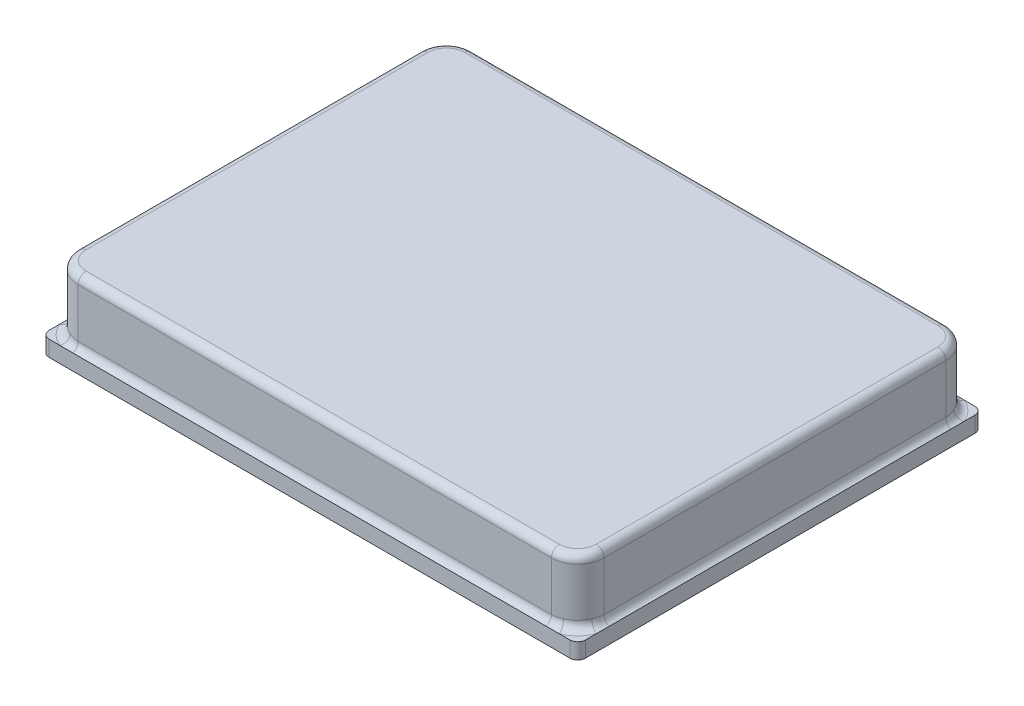
from build123d import *

# Parameters (mm, degrees)
SKETCH1_W           = 200
SKETCH1_H           = 150
SKETCH1_R           = 3
BOSS_EXTRUDE1_DEPTH = 24.5
SKETCH2_W           = 200
SKETCH2_H           = 150
BOSS_EXTRUDE2_DEPTH = 5
SKETCH3_W           = 204
SKETCH3_H           = 154
SKETCH3_W_2         = 189.5
SKETCH3_H_2         = 139.5
BOSS_EXTRUDE3_DEPTH = 5
SKETCH4_W           = 204
SKETCH4_H           = 154
SKETCH4_W_2         = 200
SKETCH4_H_2         = 150
BOSS_EXTRUDE4_DEPTH = 1
FILLET1_R           = 10
FILLET2_R           = 3


with BuildPart() as part:
    # Sketch1 → Boss-Extrude1 (new body)
    with BuildSketch(Plane(origin=(0, 0, 0), x_dir=(1, 0, 0), z_dir=(0, 1, 0))):
        with Locations((100, 75)):
            Rectangle(SKETCH1_W, SKETCH1_H)
        with BuildLine():
            Line((9.846194078, 18.9), (5.25, 18.9))
            Line((5.25, 18.9), (5.25, 131.1))
            Line((5.25, 131.1), (9.846194078, 131.1))
            ThreePointArc((9.846194078, 131.1), (16.248201641, 133.751798359), (18.9, 140.153805922))
            Line((18.9, 140.153805922), (18.9, 144.75))
            Line((18.9, 144.75), (181.1, 144.75))
            Line((181.1, 144.75), (181.1, 140.153805922))
            ThreePointArc((181.1, 140.153805922), (183.751798359, 133.751798359), (190.153805922, 131.1))
            Line((190.153805922, 131.1), (194.75, 131.1))
            Line((194.75, 131.1), (194.75, 18.9))
            Line((194.75, 18.9), (190.153805922, 18.9))
            ThreePointArc((190.153805922, 18.9), (183.751798359, 16.248201641), (181.1, 9.846194078))
            Line((181.1, 9.846194078), (181.1, 5.25))
            Line((181.1, 5.25), (18.9, 5.25))
            Line((18.9, 5.25), (18.9, 9.846194078))
            ThreePointArc((18.9, 9.846194078), (16.248201641, 16.248201641), (9.846194078, 18.9))
        make_face(mode=Mode.SUBTRACT)
        with Locations((9.846194078, 9.846194078)):
            Circle(SKETCH1_R, mode=Mode.SUBTRACT)
        with Locations((190.153805922, 9.846194078)):
            Circle(SKETCH1_R, mode=Mode.SUBTRACT)
        with Locations((190.153805922, 140.153805922)):
            Circle(SKETCH1_R, mode=Mode.SUBTRACT)
        with Locations((9.846194078, 140.153805922)):
            Circle(SKETCH1_R, mode=Mode.SUBTRACT)
    extrude(amount=BOSS_EXTRUDE1_DEPTH)

    # Sketch2 → Boss-Extrude2 (add)
    with BuildSketch(Plane(origin=(0, 24.5, 0), x_dir=(1, 0, 0), z_dir=(0, 1, 0))):
        with Locations((100, 75)):
            Rectangle(SKETCH2_W, SKETCH2_H)
    extrude(amount=BOSS_EXTRUDE2_DEPTH)

    # Sketch3 → Boss-Extrude3 (add)
    with BuildSketch(Plane.XZ):
        with Locations((100, -75)):
            Rectangle(SKETCH3_W, SKETCH3_H)
        with Locations((100, -75)):
            Rectangle(SKETCH3_W_2, SKETCH3_H_2, mode=Mode.SUBTRACT)
    extrude(amount=-BOSS_EXTRUDE3_DEPTH)

    # Sketch4 → Boss-Extrude4 (add)
    with BuildSketch(Plane.XZ):
        with Locations((100, -75)):
            Rectangle(SKETCH4_W, SKETCH4_H)
        with Locations((100, -75)):
            Rectangle(SKETCH4_W_2, SKETCH4_H_2, mode=Mode.SUBTRACT)
    extrude(amount=BOSS_EXTRUDE4_DEPTH)

    # Fillet1
    fillet1_edges = [part.edges().sort_by_distance(p)[0] for p in [
        (200, 17.25, -150),
        (200, 17.25, 0),
        (0, 17.25, -150),
        (0, 17.25, 0),
    ]]
    fillet(fillet1_edges, radius=FILLET1_R)

    # Fillet2
    fillet2_edges = [part.edges().sort_by_distance(p)[0] for p in [
        (197.071067812, 5, -2.928932188),
        (197.071067812, 5, -147.071067812),
        (2.928932188, 5, -147.071067812),
        (2.928932188, 5, -2.928932188),
        (0, 5, -75),
        (100, 5, 0),
        (100, 5, -150),
        (200, 5, -75),
    ]]
    fillet(fillet2_edges, radius=FILLET2_R)
    fillet2_2_edges = [part.edges().sort_by_distance(p)[0] for p in [
        (197.071067812, 29.5, -2.928932188),
        (100, 29.5, 0),
        (2.928932188, 29.5, -2.928932188),
        (0, 29.5, -75),
        (2.928932188, 29.5, -147.071067812),
        (100, 29.5, -150),
        (197.071067812, 29.5, -147.071067812),
        (200, 29.5, -75),
        (-2, 2, 2),
        (202, 2, 2),
        (202, 2, -152),
    ]]
    fillet(fillet2_2_edges, radius=FILLET2_R)


solid = part.part
